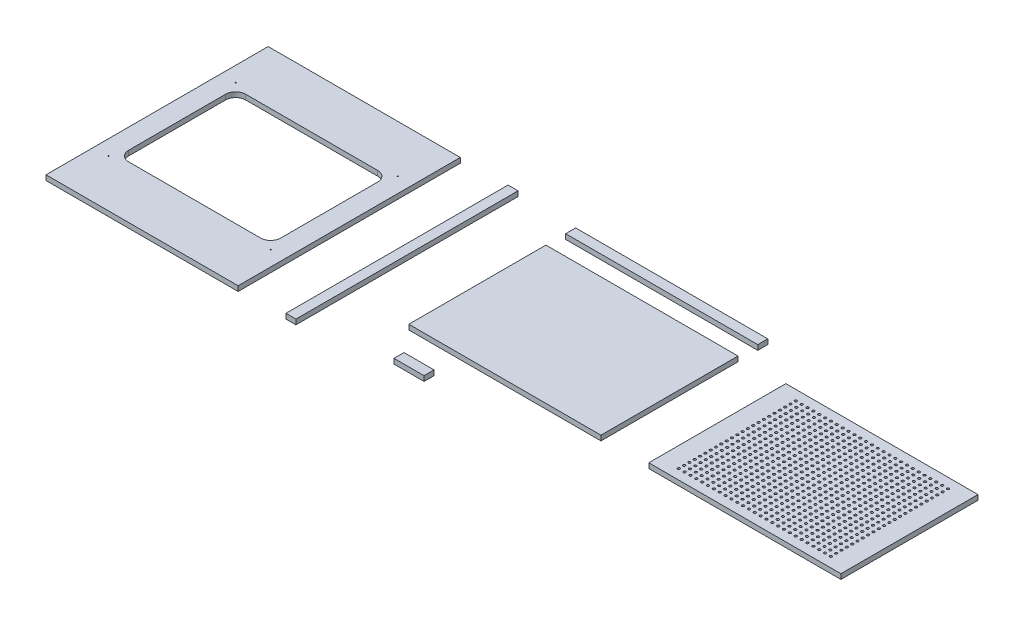
from build123d import *

# Parameters (mm, degrees)
SKETCH1_W             = 384
SKETCH1_H             = 444
SKETCH1_W_2           = 304
SKETCH1_H_2           = 234
SKETCH1_R             = 1
BOSS_EXTRUDE1_DEPTH   = 10
SKETCH1_H_3           = 274
BOSS_EXTRUDE1_2_DEPTH = 10
SKETCH1_W_3           = 20
BOSS_EXTRUDE1_3_DEPTH = 10
SKETCH1_H_4           = 20
BOSS_EXTRUDE1_4_DEPTH = 10
SKETCH1_W_4           = 60
BOSS_EXTRUDE1_5_DEPTH = 10
SKETCH1_R_2           = 2.4
BOSS_EXTRUDE1_6_DEPTH = 10
FILLET1_R             = 20


with BuildPart() as part:
    # Sketch1 → Boss-Extrude1 (new body)
    with BuildSketch(Plane(origin=(0, 0, 0), x_dir=(1, 0, 0), z_dir=(0, 1, 0))):
        Rectangle(SKETCH1_W, SKETCH1_H)
        Rectangle(SKETCH1_W_2, SKETCH1_H_2, mode=Mode.SUBTRACT)
        with Locations((162, 127)):
            Circle(SKETCH1_R, mode=Mode.SUBTRACT)
        with Locations((-162, 127)):
            Circle(SKETCH1_R, mode=Mode.SUBTRACT)
        with Locations((162, -127)):
            Circle(SKETCH1_R, mode=Mode.SUBTRACT)
        with Locations((-162, -127)):
            Circle(SKETCH1_R, mode=Mode.SUBTRACT)
    extrude(amount=BOSS_EXTRUDE1_DEPTH)

    # Fillet1
    fillet1_edges = [part.edges().sort_by_distance(p)[0] for p in [
        (-152, 5, 117),
        (152, 5, 117),
        (152, 5, -117),
        (-152, 5, -117),
    ]]
    fillet(fillet1_edges, radius=FILLET1_R)


with BuildPart() as body_2:
    # Sketch1 → Boss-Extrude1 2 (new body)
    with BuildSketch(Plane(origin=(0, 0, 0), x_dir=(1, 0, 0), z_dir=(0, 1, 0))):
        with Locations((621.209446317, 18.892233675)):
            Rectangle(SKETCH1_W, SKETCH1_H_3)
    extrude(amount=BOSS_EXTRUDE1_2_DEPTH)


with BuildPart() as body_3:
    # Sketch1 → Boss-Extrude1 3 (new body)
    with BuildSketch(Plane(origin=(0, 0, 0), x_dir=(1, 0, 0), z_dir=(0, 1, 0))):
        with Locations((297.479978554, 0)):
            Rectangle(SKETCH1_W_3, SKETCH1_H)
    extrude(amount=BOSS_EXTRUDE1_3_DEPTH)


with BuildPart() as body_4:
    # Sketch1 → Boss-Extrude1 4 (new body)
    with BuildSketch(Plane(origin=(0, 0, 0), x_dir=(1, 0, 0), z_dir=(0, 1, 0))):
        with Locations((621.209446317, 205.35486598)):
            Rectangle(SKETCH1_W, SKETCH1_H_4)
    extrude(amount=BOSS_EXTRUDE1_4_DEPTH)


with BuildPart() as body_5:
    # Sketch1 → Boss-Extrude1 5 (new body)
    with BuildSketch(Plane(origin=(0, 0, 0), x_dir=(1, 0, 0), z_dir=(0, 1, 0))):
        with Locations((503.415257306, -181.953154569)):
            Rectangle(SKETCH1_W_4, SKETCH1_H_4)
    extrude(amount=BOSS_EXTRUDE1_5_DEPTH)


with BuildPart() as body_6:
    # Sketch1 → Boss-Extrude1 6 (new body)
    with BuildSketch(Plane(origin=(0, 0, 0), x_dir=(1, 0, 0), z_dir=(0, 1, 0))):
        with Locations((1100.769882461, 18.892233675)):
            Rectangle(SKETCH1_W, SKETCH1_H_3)
        with Locations((948.769882461, -98.107766325)):
            Circle(SKETCH1_R_2, mode=Mode.SUBTRACT)
        with Locations((960.462190153, -98.107766325)):
            Circle(SKETCH1_R_2, mode=Mode.SUBTRACT)
        with Locations((972.154497845, -98.107766325)):
            Circle(SKETCH1_R_2, mode=Mode.SUBTRACT)
        with Locations((983.846805538, -98.107766325)):
            Circle(SKETCH1_R_2, mode=Mode.SUBTRACT)
        with Locations((995.53911323, -98.107766325)):
            Circle(SKETCH1_R_2, mode=Mode.SUBTRACT)
        with Locations((1007.231420922, -98.107766325)):
            Circle(SKETCH1_R_2, mode=Mode.SUBTRACT)
        with Locations((948.769882461, -87.471402688)):
            Circle(SKETCH1_R_2, mode=Mode.SUBTRACT)
        with Locations((960.462190153, -87.471402688)):
            Circle(SKETCH1_R_2, mode=Mode.SUBTRACT)
        with Locations((972.154497845, -87.471402688)):
            Circle(SKETCH1_R_2, mode=Mode.SUBTRACT)
        with Locations((983.846805538, -87.471402688)):
            Circle(SKETCH1_R_2, mode=Mode.SUBTRACT)
        with Locations((995.53911323, -87.471402688)):
            Circle(SKETCH1_R_2, mode=Mode.SUBTRACT)
        with Locations((1007.231420922, -87.471402688)):
            Circle(SKETCH1_R_2, mode=Mode.SUBTRACT)
        with Locations((1018.923728614, -98.107766325)):
            Circle(SKETCH1_R_2, mode=Mode.SUBTRACT)
        with Locations((1030.616036307, -98.107766325)):
            Circle(SKETCH1_R_2, mode=Mode.SUBTRACT)
        with Locations((1042.308343999, -98.107766325)):
            Circle(SKETCH1_R_2, mode=Mode.SUBTRACT)
        with Locations((1054.000651691, -98.107766325)):
            Circle(SKETCH1_R_2, mode=Mode.SUBTRACT)
        with Locations((1065.692959384, -98.107766325)):
            Circle(SKETCH1_R_2, mode=Mode.SUBTRACT)
        with Locations((1077.385267076, -98.107766325)):
            Circle(SKETCH1_R_2, mode=Mode.SUBTRACT)
        with Locations((1089.077574768, -98.107766325)):
            Circle(SKETCH1_R_2, mode=Mode.SUBTRACT)
        with Locations((1100.769882461, -98.107766325)):
            Circle(SKETCH1_R_2, mode=Mode.SUBTRACT)
        with Locations((1018.923728614, -87.471402688)):
            Circle(SKETCH1_R_2, mode=Mode.SUBTRACT)
        with Locations((1030.616036307, -87.471402688)):
            Circle(SKETCH1_R_2, mode=Mode.SUBTRACT)
        with Locations((1042.308343999, -87.471402688)):
            Circle(SKETCH1_R_2, mode=Mode.SUBTRACT)
        with Locations((1054.000651691, -87.471402688)):
            Circle(SKETCH1_R_2, mode=Mode.SUBTRACT)
        with Locations((1065.692959384, -87.471402688)):
            Circle(SKETCH1_R_2, mode=Mode.SUBTRACT)
        with Locations((1077.385267076, -87.471402688)):
            Circle(SKETCH1_R_2, mode=Mode.SUBTRACT)
        with Locations((1089.077574768, -87.471402688)):
            Circle(SKETCH1_R_2, mode=Mode.SUBTRACT)
        with Locations((1100.769882461, -87.471402688)):
            Circle(SKETCH1_R_2, mode=Mode.SUBTRACT)
        with Locations((948.769882461, -76.835039052)):
            Circle(SKETCH1_R_2, mode=Mode.SUBTRACT)
        with Locations((960.462190153, -76.835039052)):
            Circle(SKETCH1_R_2, mode=Mode.SUBTRACT)
        with Locations((972.154497845, -76.835039052)):
            Circle(SKETCH1_R_2, mode=Mode.SUBTRACT)
        with Locations((983.846805538, -76.835039052)):
            Circle(SKETCH1_R_2, mode=Mode.SUBTRACT)
        with Locations((995.53911323, -76.835039052)):
            Circle(SKETCH1_R_2, mode=Mode.SUBTRACT)
        with Locations((1007.231420922, -76.835039052)):
            Circle(SKETCH1_R_2, mode=Mode.SUBTRACT)
        with Locations((948.769882461, -66.198675415)):
            Circle(SKETCH1_R_2, mode=Mode.SUBTRACT)
        with Locations((960.462190153, -66.198675415)):
            Circle(SKETCH1_R_2, mode=Mode.SUBTRACT)
        with Locations((948.769882461, -55.562311779)):
            Circle(SKETCH1_R_2, mode=Mode.SUBTRACT)
        with Locations((960.462190153, -55.562311779)):
            Circle(SKETCH1_R_2, mode=Mode.SUBTRACT)
        with Locations((972.154497845, -66.198675415)):
            Circle(SKETCH1_R_2, mode=Mode.SUBTRACT)
        with Locations((983.846805538, -66.198675415)):
            Circle(SKETCH1_R_2, mode=Mode.SUBTRACT)
        with Locations((995.53911323, -66.198675415)):
            Circle(SKETCH1_R_2, mode=Mode.SUBTRACT)
        with Locations((1007.231420922, -66.198675415)):
            Circle(SKETCH1_R_2, mode=Mode.SUBTRACT)
        with Locations((972.154497845, -55.562311779)):
            Circle(SKETCH1_R_2, mode=Mode.SUBTRACT)
        with Locations((983.846805538, -55.562311779)):
            Circle(SKETCH1_R_2, mode=Mode.SUBTRACT)
        with Locations((995.53911323, -55.562311779)):
            Circle(SKETCH1_R_2, mode=Mode.SUBTRACT)
        with Locations((1007.231420922, -55.562311779)):
            Circle(SKETCH1_R_2, mode=Mode.SUBTRACT)
        with Locations((1018.923728614, -76.835039052)):
            Circle(SKETCH1_R_2, mode=Mode.SUBTRACT)
        with Locations((1030.616036307, -76.835039052)):
            Circle(SKETCH1_R_2, mode=Mode.SUBTRACT)
        with Locations((1042.308343999, -76.835039052)):
            Circle(SKETCH1_R_2, mode=Mode.SUBTRACT)
        with Locations((1054.000651691, -76.835039052)):
            Circle(SKETCH1_R_2, mode=Mode.SUBTRACT)
        with Locations((1065.692959384, -76.835039052)):
            Circle(SKETCH1_R_2, mode=Mode.SUBTRACT)
        with Locations((1077.385267076, -76.835039052)):
            Circle(SKETCH1_R_2, mode=Mode.SUBTRACT)
        with Locations((1089.077574768, -76.835039052)):
            Circle(SKETCH1_R_2, mode=Mode.SUBTRACT)
        with Locations((1100.769882461, -76.835039052)):
            Circle(SKETCH1_R_2, mode=Mode.SUBTRACT)
        with Locations((1018.923728614, -66.198675415)):
            Circle(SKETCH1_R_2, mode=Mode.SUBTRACT)
        with Locations((1030.616036307, -66.198675415)):
            Circle(SKETCH1_R_2, mode=Mode.SUBTRACT)
        with Locations((1042.308343999, -66.198675415)):
            Circle(SKETCH1_R_2, mode=Mode.SUBTRACT)
        with Locations((1054.000651691, -66.198675415)):
            Circle(SKETCH1_R_2, mode=Mode.SUBTRACT)
        with Locations((1018.923728614, -55.562311779)):
            Circle(SKETCH1_R_2, mode=Mode.SUBTRACT)
        with Locations((1030.616036307, -55.562311779)):
            Circle(SKETCH1_R_2, mode=Mode.SUBTRACT)
        with Locations((1042.308343999, -55.562311779)):
            Circle(SKETCH1_R_2, mode=Mode.SUBTRACT)
        with Locations((1054.000651691, -55.562311779)):
            Circle(SKETCH1_R_2, mode=Mode.SUBTRACT)
        with Locations((1065.692959384, -66.198675415)):
            Circle(SKETCH1_R_2, mode=Mode.SUBTRACT)
        with Locations((1077.385267076, -66.198675415)):
            Circle(SKETCH1_R_2, mode=Mode.SUBTRACT)
        with Locations((1089.077574768, -66.198675415)):
            Circle(SKETCH1_R_2, mode=Mode.SUBTRACT)
        with Locations((1100.769882461, -66.198675415)):
            Circle(SKETCH1_R_2, mode=Mode.SUBTRACT)
        with Locations((1065.692959384, -55.562311779)):
            Circle(SKETCH1_R_2, mode=Mode.SUBTRACT)
        with Locations((1077.385267076, -55.562311779)):
            Circle(SKETCH1_R_2, mode=Mode.SUBTRACT)
        with Locations((1089.077574768, -55.562311779)):
            Circle(SKETCH1_R_2, mode=Mode.SUBTRACT)
        with Locations((1100.769882461, -55.562311779)):
            Circle(SKETCH1_R_2, mode=Mode.SUBTRACT)
        with Locations((1112.462190153, -98.107766325)):
            Circle(SKETCH1_R_2, mode=Mode.SUBTRACT)
        with Locations((1124.154497845, -98.107766325)):
            Circle(SKETCH1_R_2, mode=Mode.SUBTRACT)
        with Locations((1135.846805538, -98.107766325)):
            Circle(SKETCH1_R_2, mode=Mode.SUBTRACT)
        with Locations((1147.53911323, -98.107766325)):
            Circle(SKETCH1_R_2, mode=Mode.SUBTRACT)
        with Locations((1159.231420922, -98.107766325)):
            Circle(SKETCH1_R_2, mode=Mode.SUBTRACT)
        with Locations((1170.923728614, -98.107766325)):
            Circle(SKETCH1_R_2, mode=Mode.SUBTRACT)
        with Locations((1182.616036307, -98.107766325)):
            Circle(SKETCH1_R_2, mode=Mode.SUBTRACT)
        with Locations((1194.308343999, -98.107766325)):
            Circle(SKETCH1_R_2, mode=Mode.SUBTRACT)
        with Locations((1112.462190153, -87.471402688)):
            Circle(SKETCH1_R_2, mode=Mode.SUBTRACT)
        with Locations((1124.154497845, -87.471402688)):
            Circle(SKETCH1_R_2, mode=Mode.SUBTRACT)
        with Locations((1135.846805538, -87.471402688)):
            Circle(SKETCH1_R_2, mode=Mode.SUBTRACT)
        with Locations((1147.53911323, -87.471402688)):
            Circle(SKETCH1_R_2, mode=Mode.SUBTRACT)
        with Locations((1159.231420922, -87.471402688)):
            Circle(SKETCH1_R_2, mode=Mode.SUBTRACT)
        with Locations((1170.923728614, -87.471402688)):
            Circle(SKETCH1_R_2, mode=Mode.SUBTRACT)
        with Locations((1182.616036307, -87.471402688)):
            Circle(SKETCH1_R_2, mode=Mode.SUBTRACT)
        with Locations((1194.308343999, -87.471402688)):
            Circle(SKETCH1_R_2, mode=Mode.SUBTRACT)
        with Locations((1206.000651691, -98.107766325)):
            Circle(SKETCH1_R_2, mode=Mode.SUBTRACT)
        with Locations((1217.692959384, -98.107766325)):
            Circle(SKETCH1_R_2, mode=Mode.SUBTRACT)
        with Locations((1229.385267076, -98.107766325)):
            Circle(SKETCH1_R_2, mode=Mode.SUBTRACT)
        with Locations((1241.077574768, -98.107766325)):
            Circle(SKETCH1_R_2, mode=Mode.SUBTRACT)
        with Locations((1252.769882461, -98.107766325)):
            Circle(SKETCH1_R_2, mode=Mode.SUBTRACT)
        with Locations((1206.000651691, -87.471402688)):
            Circle(SKETCH1_R_2, mode=Mode.SUBTRACT)
        with Locations((1217.692959384, -87.471402688)):
            Circle(SKETCH1_R_2, mode=Mode.SUBTRACT)
        with Locations((1229.385267076, -87.471402688)):
            Circle(SKETCH1_R_2, mode=Mode.SUBTRACT)
        with Locations((1241.077574768, -87.471402688)):
            Circle(SKETCH1_R_2, mode=Mode.SUBTRACT)
        with Locations((1252.769882461, -87.471402688)):
            Circle(SKETCH1_R_2, mode=Mode.SUBTRACT)
        with Locations((1112.462190153, -76.835039052)):
            Circle(SKETCH1_R_2, mode=Mode.SUBTRACT)
        with Locations((1124.154497845, -76.835039052)):
            Circle(SKETCH1_R_2, mode=Mode.SUBTRACT)
        with Locations((1135.846805538, -76.835039052)):
            Circle(SKETCH1_R_2, mode=Mode.SUBTRACT)
        with Locations((1147.53911323, -76.835039052)):
            Circle(SKETCH1_R_2, mode=Mode.SUBTRACT)
        with Locations((1159.231420922, -76.835039052)):
            Circle(SKETCH1_R_2, mode=Mode.SUBTRACT)
        with Locations((1170.923728614, -76.835039052)):
            Circle(SKETCH1_R_2, mode=Mode.SUBTRACT)
        with Locations((1182.616036307, -76.835039052)):
            Circle(SKETCH1_R_2, mode=Mode.SUBTRACT)
        with Locations((1194.308343999, -76.835039052)):
            Circle(SKETCH1_R_2, mode=Mode.SUBTRACT)
        with Locations((1112.462190153, -66.198675415)):
            Circle(SKETCH1_R_2, mode=Mode.SUBTRACT)
        with Locations((1124.154497845, -66.198675415)):
            Circle(SKETCH1_R_2, mode=Mode.SUBTRACT)
        with Locations((1135.846805538, -66.198675415)):
            Circle(SKETCH1_R_2, mode=Mode.SUBTRACT)
        with Locations((1147.53911323, -66.198675415)):
            Circle(SKETCH1_R_2, mode=Mode.SUBTRACT)
        with Locations((1112.462190153, -55.562311779)):
            Circle(SKETCH1_R_2, mode=Mode.SUBTRACT)
        with Locations((1124.154497845, -55.562311779)):
            Circle(SKETCH1_R_2, mode=Mode.SUBTRACT)
        with Locations((1135.846805538, -55.562311779)):
            Circle(SKETCH1_R_2, mode=Mode.SUBTRACT)
        with Locations((1147.53911323, -55.562311779)):
            Circle(SKETCH1_R_2, mode=Mode.SUBTRACT)
        with Locations((1159.231420922, -66.198675415)):
            Circle(SKETCH1_R_2, mode=Mode.SUBTRACT)
        with Locations((1170.923728614, -66.198675415)):
            Circle(SKETCH1_R_2, mode=Mode.SUBTRACT)
        with Locations((1182.616036307, -66.198675415)):
            Circle(SKETCH1_R_2, mode=Mode.SUBTRACT)
        with Locations((1194.308343999, -66.198675415)):
            Circle(SKETCH1_R_2, mode=Mode.SUBTRACT)
        with Locations((1159.231420922, -55.562311779)):
            Circle(SKETCH1_R_2, mode=Mode.SUBTRACT)
        with Locations((1170.923728614, -55.562311779)):
            Circle(SKETCH1_R_2, mode=Mode.SUBTRACT)
        with Locations((1182.616036307, -55.562311779)):
            Circle(SKETCH1_R_2, mode=Mode.SUBTRACT)
        with Locations((1194.308343999, -55.562311779)):
            Circle(SKETCH1_R_2, mode=Mode.SUBTRACT)
        with Locations((1206.000651691, -76.835039052)):
            Circle(SKETCH1_R_2, mode=Mode.SUBTRACT)
        with Locations((1217.692959384, -76.835039052)):
            Circle(SKETCH1_R_2, mode=Mode.SUBTRACT)
        with Locations((1229.385267076, -76.835039052)):
            Circle(SKETCH1_R_2, mode=Mode.SUBTRACT)
        with Locations((1241.077574768, -76.835039052)):
            Circle(SKETCH1_R_2, mode=Mode.SUBTRACT)
        with Locations((1252.769882461, -76.835039052)):
            Circle(SKETCH1_R_2, mode=Mode.SUBTRACT)
        with Locations((1206.000651691, -66.198675415)):
            Circle(SKETCH1_R_2, mode=Mode.SUBTRACT)
        with Locations((1217.692959384, -66.198675415)):
            Circle(SKETCH1_R_2, mode=Mode.SUBTRACT)
        with Locations((1229.385267076, -66.198675415)):
            Circle(SKETCH1_R_2, mode=Mode.SUBTRACT)
        with Locations((1241.077574768, -66.198675415)):
            Circle(SKETCH1_R_2, mode=Mode.SUBTRACT)
        with Locations((1206.000651691, -55.562311779)):
            Circle(SKETCH1_R_2, mode=Mode.SUBTRACT)
        with Locations((1217.692959384, -55.562311779)):
            Circle(SKETCH1_R_2, mode=Mode.SUBTRACT)
        with Locations((1229.385267076, -55.562311779)):
            Circle(SKETCH1_R_2, mode=Mode.SUBTRACT)
        with Locations((1241.077574768, -55.562311779)):
            Circle(SKETCH1_R_2, mode=Mode.SUBTRACT)
        with Locations((1252.769882461, -66.198675415)):
            Circle(SKETCH1_R_2, mode=Mode.SUBTRACT)
        with Locations((1252.769882461, -55.562311779)):
            Circle(SKETCH1_R_2, mode=Mode.SUBTRACT)
        with Locations((948.769882461, -44.925948143)):
            Circle(SKETCH1_R_2, mode=Mode.SUBTRACT)
        with Locations((960.462190153, -44.925948143)):
            Circle(SKETCH1_R_2, mode=Mode.SUBTRACT)
        with Locations((972.154497845, -44.925948143)):
            Circle(SKETCH1_R_2, mode=Mode.SUBTRACT)
        with Locations((983.846805538, -44.925948143)):
            Circle(SKETCH1_R_2, mode=Mode.SUBTRACT)
        with Locations((995.53911323, -44.925948143)):
            Circle(SKETCH1_R_2, mode=Mode.SUBTRACT)
        with Locations((1007.231420922, -44.925948143)):
            Circle(SKETCH1_R_2, mode=Mode.SUBTRACT)
        with Locations((948.769882461, -34.289584506)):
            Circle(SKETCH1_R_2, mode=Mode.SUBTRACT)
        with Locations((960.462190153, -34.289584506)):
            Circle(SKETCH1_R_2, mode=Mode.SUBTRACT)
        with Locations((972.154497845, -34.289584506)):
            Circle(SKETCH1_R_2, mode=Mode.SUBTRACT)
        with Locations((983.846805538, -34.289584506)):
            Circle(SKETCH1_R_2, mode=Mode.SUBTRACT)
        with Locations((995.53911323, -34.289584506)):
            Circle(SKETCH1_R_2, mode=Mode.SUBTRACT)
        with Locations((1007.231420922, -34.289584506)):
            Circle(SKETCH1_R_2, mode=Mode.SUBTRACT)
        with Locations((1018.923728614, -44.925948143)):
            Circle(SKETCH1_R_2, mode=Mode.SUBTRACT)
        with Locations((1030.616036307, -44.925948143)):
            Circle(SKETCH1_R_2, mode=Mode.SUBTRACT)
        with Locations((1042.308343999, -44.925948143)):
            Circle(SKETCH1_R_2, mode=Mode.SUBTRACT)
        with Locations((1054.000651691, -44.925948143)):
            Circle(SKETCH1_R_2, mode=Mode.SUBTRACT)
        with Locations((1065.692959384, -44.925948143)):
            Circle(SKETCH1_R_2, mode=Mode.SUBTRACT)
        with Locations((1077.385267076, -44.925948143)):
            Circle(SKETCH1_R_2, mode=Mode.SUBTRACT)
        with Locations((1089.077574768, -44.925948143)):
            Circle(SKETCH1_R_2, mode=Mode.SUBTRACT)
        with Locations((1100.769882461, -44.925948143)):
            Circle(SKETCH1_R_2, mode=Mode.SUBTRACT)
        with Locations((1018.923728614, -34.289584506)):
            Circle(SKETCH1_R_2, mode=Mode.SUBTRACT)
        with Locations((1030.616036307, -34.289584506)):
            Circle(SKETCH1_R_2, mode=Mode.SUBTRACT)
        with Locations((1042.308343999, -34.289584506)):
            Circle(SKETCH1_R_2, mode=Mode.SUBTRACT)
        with Locations((1054.000651691, -34.289584506)):
            Circle(SKETCH1_R_2, mode=Mode.SUBTRACT)
        with Locations((1065.692959384, -34.289584506)):
            Circle(SKETCH1_R_2, mode=Mode.SUBTRACT)
        with Locations((1077.385267076, -34.289584506)):
            Circle(SKETCH1_R_2, mode=Mode.SUBTRACT)
        with Locations((1089.077574768, -34.289584506)):
            Circle(SKETCH1_R_2, mode=Mode.SUBTRACT)
        with Locations((1100.769882461, -34.289584506)):
            Circle(SKETCH1_R_2, mode=Mode.SUBTRACT)
        with Locations((948.769882461, -23.65322087)):
            Circle(SKETCH1_R_2, mode=Mode.SUBTRACT)
        with Locations((960.462190153, -23.65322087)):
            Circle(SKETCH1_R_2, mode=Mode.SUBTRACT)
        with Locations((972.154497845, -23.65322087)):
            Circle(SKETCH1_R_2, mode=Mode.SUBTRACT)
        with Locations((983.846805538, -23.65322087)):
            Circle(SKETCH1_R_2, mode=Mode.SUBTRACT)
        with Locations((995.53911323, -23.65322087)):
            Circle(SKETCH1_R_2, mode=Mode.SUBTRACT)
        with Locations((1007.231420922, -23.65322087)):
            Circle(SKETCH1_R_2, mode=Mode.SUBTRACT)
        with Locations((948.769882461, -13.016857234)):
            Circle(SKETCH1_R_2, mode=Mode.SUBTRACT)
        with Locations((960.462190153, -13.016857234)):
            Circle(SKETCH1_R_2, mode=Mode.SUBTRACT)
        with Locations((948.769882461, -2.380493597)):
            Circle(SKETCH1_R_2, mode=Mode.SUBTRACT)
        with Locations((960.462190153, -2.380493597)):
            Circle(SKETCH1_R_2, mode=Mode.SUBTRACT)
        with Locations((972.154497845, -13.016857234)):
            Circle(SKETCH1_R_2, mode=Mode.SUBTRACT)
        with Locations((983.846805538, -13.016857234)):
            Circle(SKETCH1_R_2, mode=Mode.SUBTRACT)
        with Locations((995.53911323, -13.016857234)):
            Circle(SKETCH1_R_2, mode=Mode.SUBTRACT)
        with Locations((1007.231420922, -13.016857234)):
            Circle(SKETCH1_R_2, mode=Mode.SUBTRACT)
        with Locations((972.154497845, -2.380493597)):
            Circle(SKETCH1_R_2, mode=Mode.SUBTRACT)
        with Locations((983.846805538, -2.380493597)):
            Circle(SKETCH1_R_2, mode=Mode.SUBTRACT)
        with Locations((995.53911323, -2.380493597)):
            Circle(SKETCH1_R_2, mode=Mode.SUBTRACT)
        with Locations((1007.231420922, -2.380493597)):
            Circle(SKETCH1_R_2, mode=Mode.SUBTRACT)
        with Locations((1018.923728614, -23.65322087)):
            Circle(SKETCH1_R_2, mode=Mode.SUBTRACT)
        with Locations((1030.616036307, -23.65322087)):
            Circle(SKETCH1_R_2, mode=Mode.SUBTRACT)
        with Locations((1042.308343999, -23.65322087)):
            Circle(SKETCH1_R_2, mode=Mode.SUBTRACT)
        with Locations((1054.000651691, -23.65322087)):
            Circle(SKETCH1_R_2, mode=Mode.SUBTRACT)
        with Locations((1065.692959384, -23.65322087)):
            Circle(SKETCH1_R_2, mode=Mode.SUBTRACT)
        with Locations((1077.385267076, -23.65322087)):
            Circle(SKETCH1_R_2, mode=Mode.SUBTRACT)
        with Locations((1089.077574768, -23.65322087)):
            Circle(SKETCH1_R_2, mode=Mode.SUBTRACT)
        with Locations((1100.769882461, -23.65322087)):
            Circle(SKETCH1_R_2, mode=Mode.SUBTRACT)
        with Locations((1018.923728614, -13.016857234)):
            Circle(SKETCH1_R_2, mode=Mode.SUBTRACT)
        with Locations((1030.616036307, -13.016857234)):
            Circle(SKETCH1_R_2, mode=Mode.SUBTRACT)
        with Locations((1042.308343999, -13.016857234)):
            Circle(SKETCH1_R_2, mode=Mode.SUBTRACT)
        with Locations((1054.000651691, -13.016857234)):
            Circle(SKETCH1_R_2, mode=Mode.SUBTRACT)
        with Locations((1018.923728614, -2.380493597)):
            Circle(SKETCH1_R_2, mode=Mode.SUBTRACT)
        with Locations((1030.616036307, -2.380493597)):
            Circle(SKETCH1_R_2, mode=Mode.SUBTRACT)
        with Locations((1042.308343999, -2.380493597)):
            Circle(SKETCH1_R_2, mode=Mode.SUBTRACT)
        with Locations((1054.000651691, -2.380493597)):
            Circle(SKETCH1_R_2, mode=Mode.SUBTRACT)
        with Locations((1065.692959384, -13.016857234)):
            Circle(SKETCH1_R_2, mode=Mode.SUBTRACT)
        with Locations((1077.385267076, -13.016857234)):
            Circle(SKETCH1_R_2, mode=Mode.SUBTRACT)
        with Locations((1089.077574768, -13.016857234)):
            Circle(SKETCH1_R_2, mode=Mode.SUBTRACT)
        with Locations((1100.769882461, -13.016857234)):
            Circle(SKETCH1_R_2, mode=Mode.SUBTRACT)
        with Locations((1065.692959384, -2.380493597)):
            Circle(SKETCH1_R_2, mode=Mode.SUBTRACT)
        with Locations((1077.385267076, -2.380493597)):
            Circle(SKETCH1_R_2, mode=Mode.SUBTRACT)
        with Locations((1089.077574768, -2.380493597)):
            Circle(SKETCH1_R_2, mode=Mode.SUBTRACT)
        with Locations((1100.769882461, -2.380493597)):
            Circle(SKETCH1_R_2, mode=Mode.SUBTRACT)
        with Locations((1112.462190153, -44.925948143)):
            Circle(SKETCH1_R_2, mode=Mode.SUBTRACT)
        with Locations((1124.154497845, -44.925948143)):
            Circle(SKETCH1_R_2, mode=Mode.SUBTRACT)
        with Locations((1135.846805538, -44.925948143)):
            Circle(SKETCH1_R_2, mode=Mode.SUBTRACT)
        with Locations((1147.53911323, -44.925948143)):
            Circle(SKETCH1_R_2, mode=Mode.SUBTRACT)
        with Locations((1159.231420922, -44.925948143)):
            Circle(SKETCH1_R_2, mode=Mode.SUBTRACT)
        with Locations((1170.923728614, -44.925948143)):
            Circle(SKETCH1_R_2, mode=Mode.SUBTRACT)
        with Locations((1182.616036307, -44.925948143)):
            Circle(SKETCH1_R_2, mode=Mode.SUBTRACT)
        with Locations((1194.308343999, -44.925948143)):
            Circle(SKETCH1_R_2, mode=Mode.SUBTRACT)
        with Locations((1112.462190153, -34.289584506)):
            Circle(SKETCH1_R_2, mode=Mode.SUBTRACT)
        with Locations((1124.154497845, -34.289584506)):
            Circle(SKETCH1_R_2, mode=Mode.SUBTRACT)
        with Locations((1135.846805538, -34.289584506)):
            Circle(SKETCH1_R_2, mode=Mode.SUBTRACT)
        with Locations((1147.53911323, -34.289584506)):
            Circle(SKETCH1_R_2, mode=Mode.SUBTRACT)
        with Locations((1159.231420922, -34.289584506)):
            Circle(SKETCH1_R_2, mode=Mode.SUBTRACT)
        with Locations((1170.923728614, -34.289584506)):
            Circle(SKETCH1_R_2, mode=Mode.SUBTRACT)
        with Locations((1182.616036307, -34.289584506)):
            Circle(SKETCH1_R_2, mode=Mode.SUBTRACT)
        with Locations((1194.308343999, -34.289584506)):
            Circle(SKETCH1_R_2, mode=Mode.SUBTRACT)
        with Locations((1206.000651691, -44.925948143)):
            Circle(SKETCH1_R_2, mode=Mode.SUBTRACT)
        with Locations((1217.692959384, -44.925948143)):
            Circle(SKETCH1_R_2, mode=Mode.SUBTRACT)
        with Locations((1229.385267076, -44.925948143)):
            Circle(SKETCH1_R_2, mode=Mode.SUBTRACT)
        with Locations((1241.077574768, -44.925948143)):
            Circle(SKETCH1_R_2, mode=Mode.SUBTRACT)
        with Locations((1252.769882461, -44.925948143)):
            Circle(SKETCH1_R_2, mode=Mode.SUBTRACT)
        with Locations((1206.000651691, -34.289584506)):
            Circle(SKETCH1_R_2, mode=Mode.SUBTRACT)
        with Locations((1217.692959384, -34.289584506)):
            Circle(SKETCH1_R_2, mode=Mode.SUBTRACT)
        with Locations((1229.385267076, -34.289584506)):
            Circle(SKETCH1_R_2, mode=Mode.SUBTRACT)
        with Locations((1241.077574768, -34.289584506)):
            Circle(SKETCH1_R_2, mode=Mode.SUBTRACT)
        with Locations((1252.769882461, -34.289584506)):
            Circle(SKETCH1_R_2, mode=Mode.SUBTRACT)
        with Locations((1112.462190153, -23.65322087)):
            Circle(SKETCH1_R_2, mode=Mode.SUBTRACT)
        with Locations((1124.154497845, -23.65322087)):
            Circle(SKETCH1_R_2, mode=Mode.SUBTRACT)
        with Locations((1135.846805538, -23.65322087)):
            Circle(SKETCH1_R_2, mode=Mode.SUBTRACT)
        with Locations((1147.53911323, -23.65322087)):
            Circle(SKETCH1_R_2, mode=Mode.SUBTRACT)
        with Locations((1159.231420922, -23.65322087)):
            Circle(SKETCH1_R_2, mode=Mode.SUBTRACT)
        with Locations((1170.923728614, -23.65322087)):
            Circle(SKETCH1_R_2, mode=Mode.SUBTRACT)
        with Locations((1182.616036307, -23.65322087)):
            Circle(SKETCH1_R_2, mode=Mode.SUBTRACT)
        with Locations((1194.308343999, -23.65322087)):
            Circle(SKETCH1_R_2, mode=Mode.SUBTRACT)
        with Locations((1112.462190153, -13.016857234)):
            Circle(SKETCH1_R_2, mode=Mode.SUBTRACT)
        with Locations((1124.154497845, -13.016857234)):
            Circle(SKETCH1_R_2, mode=Mode.SUBTRACT)
        with Locations((1135.846805538, -13.016857234)):
            Circle(SKETCH1_R_2, mode=Mode.SUBTRACT)
        with Locations((1147.53911323, -13.016857234)):
            Circle(SKETCH1_R_2, mode=Mode.SUBTRACT)
        with Locations((1112.462190153, -2.380493597)):
            Circle(SKETCH1_R_2, mode=Mode.SUBTRACT)
        with Locations((1124.154497845, -2.380493597)):
            Circle(SKETCH1_R_2, mode=Mode.SUBTRACT)
        with Locations((1135.846805538, -2.380493597)):
            Circle(SKETCH1_R_2, mode=Mode.SUBTRACT)
        with Locations((1147.53911323, -2.380493597)):
            Circle(SKETCH1_R_2, mode=Mode.SUBTRACT)
        with Locations((1159.231420922, -13.016857234)):
            Circle(SKETCH1_R_2, mode=Mode.SUBTRACT)
        with Locations((1170.923728614, -13.016857234)):
            Circle(SKETCH1_R_2, mode=Mode.SUBTRACT)
        with Locations((1182.616036307, -13.016857234)):
            Circle(SKETCH1_R_2, mode=Mode.SUBTRACT)
        with Locations((1194.308343999, -13.016857234)):
            Circle(SKETCH1_R_2, mode=Mode.SUBTRACT)
        with Locations((1159.231420922, -2.380493597)):
            Circle(SKETCH1_R_2, mode=Mode.SUBTRACT)
        with Locations((1170.923728614, -2.380493597)):
            Circle(SKETCH1_R_2, mode=Mode.SUBTRACT)
        with Locations((1182.616036307, -2.380493597)):
            Circle(SKETCH1_R_2, mode=Mode.SUBTRACT)
        with Locations((1194.308343999, -2.380493597)):
            Circle(SKETCH1_R_2, mode=Mode.SUBTRACT)
        with Locations((1206.000651691, -23.65322087)):
            Circle(SKETCH1_R_2, mode=Mode.SUBTRACT)
        with Locations((1217.692959384, -23.65322087)):
            Circle(SKETCH1_R_2, mode=Mode.SUBTRACT)
        with Locations((1229.385267076, -23.65322087)):
            Circle(SKETCH1_R_2, mode=Mode.SUBTRACT)
        with Locations((1241.077574768, -23.65322087)):
            Circle(SKETCH1_R_2, mode=Mode.SUBTRACT)
        with Locations((1252.769882461, -23.65322087)):
            Circle(SKETCH1_R_2, mode=Mode.SUBTRACT)
        with Locations((1206.000651691, -13.016857234)):
            Circle(SKETCH1_R_2, mode=Mode.SUBTRACT)
        with Locations((1217.692959384, -13.016857234)):
            Circle(SKETCH1_R_2, mode=Mode.SUBTRACT)
        with Locations((1229.385267076, -13.016857234)):
            Circle(SKETCH1_R_2, mode=Mode.SUBTRACT)
        with Locations((1241.077574768, -13.016857234)):
            Circle(SKETCH1_R_2, mode=Mode.SUBTRACT)
        with Locations((1206.000651691, -2.380493597)):
            Circle(SKETCH1_R_2, mode=Mode.SUBTRACT)
        with Locations((1217.692959384, -2.380493597)):
            Circle(SKETCH1_R_2, mode=Mode.SUBTRACT)
        with Locations((1229.385267076, -2.380493597)):
            Circle(SKETCH1_R_2, mode=Mode.SUBTRACT)
        with Locations((1241.077574768, -2.380493597)):
            Circle(SKETCH1_R_2, mode=Mode.SUBTRACT)
        with Locations((1252.769882461, -13.016857234)):
            Circle(SKETCH1_R_2, mode=Mode.SUBTRACT)
        with Locations((1252.769882461, -2.380493597)):
            Circle(SKETCH1_R_2, mode=Mode.SUBTRACT)
        with Locations((948.769882461, 8.255870039)):
            Circle(SKETCH1_R_2, mode=Mode.SUBTRACT)
        with Locations((960.462190153, 8.255870039)):
            Circle(SKETCH1_R_2, mode=Mode.SUBTRACT)
        with Locations((972.154497845, 8.255870039)):
            Circle(SKETCH1_R_2, mode=Mode.SUBTRACT)
        with Locations((983.846805538, 8.255870039)):
            Circle(SKETCH1_R_2, mode=Mode.SUBTRACT)
        with Locations((995.53911323, 8.255870039)):
            Circle(SKETCH1_R_2, mode=Mode.SUBTRACT)
        with Locations((1007.231420922, 8.255870039)):
            Circle(SKETCH1_R_2, mode=Mode.SUBTRACT)
        with Locations((948.769882461, 18.892233675)):
            Circle(SKETCH1_R_2, mode=Mode.SUBTRACT)
        with Locations((960.462190153, 18.892233675)):
            Circle(SKETCH1_R_2, mode=Mode.SUBTRACT)
        with Locations((972.154497845, 18.892233675)):
            Circle(SKETCH1_R_2, mode=Mode.SUBTRACT)
        with Locations((983.846805538, 18.892233675)):
            Circle(SKETCH1_R_2, mode=Mode.SUBTRACT)
        with Locations((995.53911323, 18.892233675)):
            Circle(SKETCH1_R_2, mode=Mode.SUBTRACT)
        with Locations((1007.231420922, 18.892233675)):
            Circle(SKETCH1_R_2, mode=Mode.SUBTRACT)
        with Locations((1018.923728614, 8.255870039)):
            Circle(SKETCH1_R_2, mode=Mode.SUBTRACT)
        with Locations((1030.616036307, 8.255870039)):
            Circle(SKETCH1_R_2, mode=Mode.SUBTRACT)
        with Locations((1042.308343999, 8.255870039)):
            Circle(SKETCH1_R_2, mode=Mode.SUBTRACT)
        with Locations((1054.000651691, 8.255870039)):
            Circle(SKETCH1_R_2, mode=Mode.SUBTRACT)
        with Locations((1065.692959384, 8.255870039)):
            Circle(SKETCH1_R_2, mode=Mode.SUBTRACT)
        with Locations((1077.385267076, 8.255870039)):
            Circle(SKETCH1_R_2, mode=Mode.SUBTRACT)
        with Locations((1089.077574768, 8.255870039)):
            Circle(SKETCH1_R_2, mode=Mode.SUBTRACT)
        with Locations((1100.769882461, 8.255870039)):
            Circle(SKETCH1_R_2, mode=Mode.SUBTRACT)
        with Locations((1018.923728614, 18.892233675)):
            Circle(SKETCH1_R_2, mode=Mode.SUBTRACT)
        with Locations((1030.616036307, 18.892233675)):
            Circle(SKETCH1_R_2, mode=Mode.SUBTRACT)
        with Locations((1042.308343999, 18.892233675)):
            Circle(SKETCH1_R_2, mode=Mode.SUBTRACT)
        with Locations((1054.000651691, 18.892233675)):
            Circle(SKETCH1_R_2, mode=Mode.SUBTRACT)
        with Locations((1065.692959384, 18.892233675)):
            Circle(SKETCH1_R_2, mode=Mode.SUBTRACT)
        with Locations((1077.385267076, 18.892233675)):
            Circle(SKETCH1_R_2, mode=Mode.SUBTRACT)
        with Locations((1089.077574768, 18.892233675)):
            Circle(SKETCH1_R_2, mode=Mode.SUBTRACT)
        with Locations((1100.769882461, 18.892233675)):
            Circle(SKETCH1_R_2, mode=Mode.SUBTRACT)
        with Locations((948.769882461, 29.528597312)):
            Circle(SKETCH1_R_2, mode=Mode.SUBTRACT)
        with Locations((960.462190153, 29.528597312)):
            Circle(SKETCH1_R_2, mode=Mode.SUBTRACT)
        with Locations((948.769882461, 40.164960948)):
            Circle(SKETCH1_R_2, mode=Mode.SUBTRACT)
        with Locations((960.462190153, 40.164960948)):
            Circle(SKETCH1_R_2, mode=Mode.SUBTRACT)
        with Locations((972.154497845, 29.528597312)):
            Circle(SKETCH1_R_2, mode=Mode.SUBTRACT)
        with Locations((983.846805538, 29.528597312)):
            Circle(SKETCH1_R_2, mode=Mode.SUBTRACT)
        with Locations((995.53911323, 29.528597312)):
            Circle(SKETCH1_R_2, mode=Mode.SUBTRACT)
        with Locations((1007.231420922, 29.528597312)):
            Circle(SKETCH1_R_2, mode=Mode.SUBTRACT)
        with Locations((972.154497845, 40.164960948)):
            Circle(SKETCH1_R_2, mode=Mode.SUBTRACT)
        with Locations((983.846805538, 40.164960948)):
            Circle(SKETCH1_R_2, mode=Mode.SUBTRACT)
        with Locations((995.53911323, 40.164960948)):
            Circle(SKETCH1_R_2, mode=Mode.SUBTRACT)
        with Locations((1007.231420922, 40.164960948)):
            Circle(SKETCH1_R_2, mode=Mode.SUBTRACT)
        with Locations((948.769882461, 50.801324585)):
            Circle(SKETCH1_R_2, mode=Mode.SUBTRACT)
        with Locations((960.462190153, 50.801324585)):
            Circle(SKETCH1_R_2, mode=Mode.SUBTRACT)
        with Locations((972.154497845, 50.801324585)):
            Circle(SKETCH1_R_2, mode=Mode.SUBTRACT)
        with Locations((983.846805538, 50.801324585)):
            Circle(SKETCH1_R_2, mode=Mode.SUBTRACT)
        with Locations((995.53911323, 50.801324585)):
            Circle(SKETCH1_R_2, mode=Mode.SUBTRACT)
        with Locations((1007.231420922, 50.801324585)):
            Circle(SKETCH1_R_2, mode=Mode.SUBTRACT)
        with Locations((1018.923728614, 29.528597312)):
            Circle(SKETCH1_R_2, mode=Mode.SUBTRACT)
        with Locations((1030.616036307, 29.528597312)):
            Circle(SKETCH1_R_2, mode=Mode.SUBTRACT)
        with Locations((1042.308343999, 29.528597312)):
            Circle(SKETCH1_R_2, mode=Mode.SUBTRACT)
        with Locations((1054.000651691, 29.528597312)):
            Circle(SKETCH1_R_2, mode=Mode.SUBTRACT)
        with Locations((1018.923728614, 40.164960948)):
            Circle(SKETCH1_R_2, mode=Mode.SUBTRACT)
        with Locations((1030.616036307, 40.164960948)):
            Circle(SKETCH1_R_2, mode=Mode.SUBTRACT)
        with Locations((1042.308343999, 40.164960948)):
            Circle(SKETCH1_R_2, mode=Mode.SUBTRACT)
        with Locations((1054.000651691, 40.164960948)):
            Circle(SKETCH1_R_2, mode=Mode.SUBTRACT)
        with Locations((1065.692959384, 29.528597312)):
            Circle(SKETCH1_R_2, mode=Mode.SUBTRACT)
        with Locations((1077.385267076, 29.528597312)):
            Circle(SKETCH1_R_2, mode=Mode.SUBTRACT)
        with Locations((1089.077574768, 29.528597312)):
            Circle(SKETCH1_R_2, mode=Mode.SUBTRACT)
        with Locations((1100.769882461, 29.528597312)):
            Circle(SKETCH1_R_2, mode=Mode.SUBTRACT)
        with Locations((1065.692959384, 40.164960948)):
            Circle(SKETCH1_R_2, mode=Mode.SUBTRACT)
        with Locations((1077.385267076, 40.164960948)):
            Circle(SKETCH1_R_2, mode=Mode.SUBTRACT)
        with Locations((1089.077574768, 40.164960948)):
            Circle(SKETCH1_R_2, mode=Mode.SUBTRACT)
        with Locations((1100.769882461, 40.164960948)):
            Circle(SKETCH1_R_2, mode=Mode.SUBTRACT)
        with Locations((1018.923728614, 50.801324585)):
            Circle(SKETCH1_R_2, mode=Mode.SUBTRACT)
        with Locations((1030.616036307, 50.801324585)):
            Circle(SKETCH1_R_2, mode=Mode.SUBTRACT)
        with Locations((1042.308343999, 50.801324585)):
            Circle(SKETCH1_R_2, mode=Mode.SUBTRACT)
        with Locations((1054.000651691, 50.801324585)):
            Circle(SKETCH1_R_2, mode=Mode.SUBTRACT)
        with Locations((1065.692959384, 50.801324585)):
            Circle(SKETCH1_R_2, mode=Mode.SUBTRACT)
        with Locations((1077.385267076, 50.801324585)):
            Circle(SKETCH1_R_2, mode=Mode.SUBTRACT)
        with Locations((1089.077574768, 50.801324585)):
            Circle(SKETCH1_R_2, mode=Mode.SUBTRACT)
        with Locations((1100.769882461, 50.801324585)):
            Circle(SKETCH1_R_2, mode=Mode.SUBTRACT)
        with Locations((1112.462190153, 8.255870039)):
            Circle(SKETCH1_R_2, mode=Mode.SUBTRACT)
        with Locations((1124.154497845, 8.255870039)):
            Circle(SKETCH1_R_2, mode=Mode.SUBTRACT)
        with Locations((1135.846805538, 8.255870039)):
            Circle(SKETCH1_R_2, mode=Mode.SUBTRACT)
        with Locations((1147.53911323, 8.255870039)):
            Circle(SKETCH1_R_2, mode=Mode.SUBTRACT)
        with Locations((1159.231420922, 8.255870039)):
            Circle(SKETCH1_R_2, mode=Mode.SUBTRACT)
        with Locations((1170.923728614, 8.255870039)):
            Circle(SKETCH1_R_2, mode=Mode.SUBTRACT)
        with Locations((1182.616036307, 8.255870039)):
            Circle(SKETCH1_R_2, mode=Mode.SUBTRACT)
        with Locations((1194.308343999, 8.255870039)):
            Circle(SKETCH1_R_2, mode=Mode.SUBTRACT)
        with Locations((1112.462190153, 18.892233675)):
            Circle(SKETCH1_R_2, mode=Mode.SUBTRACT)
        with Locations((1124.154497845, 18.892233675)):
            Circle(SKETCH1_R_2, mode=Mode.SUBTRACT)
        with Locations((1135.846805538, 18.892233675)):
            Circle(SKETCH1_R_2, mode=Mode.SUBTRACT)
        with Locations((1147.53911323, 18.892233675)):
            Circle(SKETCH1_R_2, mode=Mode.SUBTRACT)
        with Locations((1159.231420922, 18.892233675)):
            Circle(SKETCH1_R_2, mode=Mode.SUBTRACT)
        with Locations((1170.923728614, 18.892233675)):
            Circle(SKETCH1_R_2, mode=Mode.SUBTRACT)
        with Locations((1182.616036307, 18.892233675)):
            Circle(SKETCH1_R_2, mode=Mode.SUBTRACT)
        with Locations((1194.308343999, 18.892233675)):
            Circle(SKETCH1_R_2, mode=Mode.SUBTRACT)
        with Locations((1206.000651691, 8.255870039)):
            Circle(SKETCH1_R_2, mode=Mode.SUBTRACT)
        with Locations((1217.692959384, 8.255870039)):
            Circle(SKETCH1_R_2, mode=Mode.SUBTRACT)
        with Locations((1229.385267076, 8.255870039)):
            Circle(SKETCH1_R_2, mode=Mode.SUBTRACT)
        with Locations((1241.077574768, 8.255870039)):
            Circle(SKETCH1_R_2, mode=Mode.SUBTRACT)
        with Locations((1252.769882461, 8.255870039)):
            Circle(SKETCH1_R_2, mode=Mode.SUBTRACT)
        with Locations((1206.000651691, 18.892233675)):
            Circle(SKETCH1_R_2, mode=Mode.SUBTRACT)
        with Locations((1217.692959384, 18.892233675)):
            Circle(SKETCH1_R_2, mode=Mode.SUBTRACT)
        with Locations((1229.385267076, 18.892233675)):
            Circle(SKETCH1_R_2, mode=Mode.SUBTRACT)
        with Locations((1241.077574768, 18.892233675)):
            Circle(SKETCH1_R_2, mode=Mode.SUBTRACT)
        with Locations((1252.769882461, 18.892233675)):
            Circle(SKETCH1_R_2, mode=Mode.SUBTRACT)
        with Locations((1112.462190153, 29.528597312)):
            Circle(SKETCH1_R_2, mode=Mode.SUBTRACT)
        with Locations((1124.154497845, 29.528597312)):
            Circle(SKETCH1_R_2, mode=Mode.SUBTRACT)
        with Locations((1135.846805538, 29.528597312)):
            Circle(SKETCH1_R_2, mode=Mode.SUBTRACT)
        with Locations((1147.53911323, 29.528597312)):
            Circle(SKETCH1_R_2, mode=Mode.SUBTRACT)
        with Locations((1112.462190153, 40.164960948)):
            Circle(SKETCH1_R_2, mode=Mode.SUBTRACT)
        with Locations((1124.154497845, 40.164960948)):
            Circle(SKETCH1_R_2, mode=Mode.SUBTRACT)
        with Locations((1135.846805538, 40.164960948)):
            Circle(SKETCH1_R_2, mode=Mode.SUBTRACT)
        with Locations((1147.53911323, 40.164960948)):
            Circle(SKETCH1_R_2, mode=Mode.SUBTRACT)
        with Locations((1159.231420922, 29.528597312)):
            Circle(SKETCH1_R_2, mode=Mode.SUBTRACT)
        with Locations((1170.923728614, 29.528597312)):
            Circle(SKETCH1_R_2, mode=Mode.SUBTRACT)
        with Locations((1182.616036307, 29.528597312)):
            Circle(SKETCH1_R_2, mode=Mode.SUBTRACT)
        with Locations((1194.308343999, 29.528597312)):
            Circle(SKETCH1_R_2, mode=Mode.SUBTRACT)
        with Locations((1159.231420922, 40.164960948)):
            Circle(SKETCH1_R_2, mode=Mode.SUBTRACT)
        with Locations((1170.923728614, 40.164960948)):
            Circle(SKETCH1_R_2, mode=Mode.SUBTRACT)
        with Locations((1182.616036307, 40.164960948)):
            Circle(SKETCH1_R_2, mode=Mode.SUBTRACT)
        with Locations((1194.308343999, 40.164960948)):
            Circle(SKETCH1_R_2, mode=Mode.SUBTRACT)
        with Locations((1112.462190153, 50.801324585)):
            Circle(SKETCH1_R_2, mode=Mode.SUBTRACT)
        with Locations((1124.154497845, 50.801324585)):
            Circle(SKETCH1_R_2, mode=Mode.SUBTRACT)
        with Locations((1135.846805538, 50.801324585)):
            Circle(SKETCH1_R_2, mode=Mode.SUBTRACT)
        with Locations((1147.53911323, 50.801324585)):
            Circle(SKETCH1_R_2, mode=Mode.SUBTRACT)
        with Locations((1159.231420922, 50.801324585)):
            Circle(SKETCH1_R_2, mode=Mode.SUBTRACT)
        with Locations((1170.923728614, 50.801324585)):
            Circle(SKETCH1_R_2, mode=Mode.SUBTRACT)
        with Locations((1182.616036307, 50.801324585)):
            Circle(SKETCH1_R_2, mode=Mode.SUBTRACT)
        with Locations((1194.308343999, 50.801324585)):
            Circle(SKETCH1_R_2, mode=Mode.SUBTRACT)
        with Locations((1206.000651691, 29.528597312)):
            Circle(SKETCH1_R_2, mode=Mode.SUBTRACT)
        with Locations((1217.692959384, 29.528597312)):
            Circle(SKETCH1_R_2, mode=Mode.SUBTRACT)
        with Locations((1229.385267076, 29.528597312)):
            Circle(SKETCH1_R_2, mode=Mode.SUBTRACT)
        with Locations((1241.077574768, 29.528597312)):
            Circle(SKETCH1_R_2, mode=Mode.SUBTRACT)
        with Locations((1206.000651691, 40.164960948)):
            Circle(SKETCH1_R_2, mode=Mode.SUBTRACT)
        with Locations((1217.692959384, 40.164960948)):
            Circle(SKETCH1_R_2, mode=Mode.SUBTRACT)
        with Locations((1229.385267076, 40.164960948)):
            Circle(SKETCH1_R_2, mode=Mode.SUBTRACT)
        with Locations((1241.077574768, 40.164960948)):
            Circle(SKETCH1_R_2, mode=Mode.SUBTRACT)
        with Locations((1252.769882461, 29.528597312)):
            Circle(SKETCH1_R_2, mode=Mode.SUBTRACT)
        with Locations((1252.769882461, 40.164960948)):
            Circle(SKETCH1_R_2, mode=Mode.SUBTRACT)
        with Locations((1206.000651691, 50.801324585)):
            Circle(SKETCH1_R_2, mode=Mode.SUBTRACT)
        with Locations((1217.692959384, 50.801324585)):
            Circle(SKETCH1_R_2, mode=Mode.SUBTRACT)
        with Locations((1229.385267076, 50.801324585)):
            Circle(SKETCH1_R_2, mode=Mode.SUBTRACT)
        with Locations((1241.077574768, 50.801324585)):
            Circle(SKETCH1_R_2, mode=Mode.SUBTRACT)
        with Locations((1252.769882461, 50.801324585)):
            Circle(SKETCH1_R_2, mode=Mode.SUBTRACT)
        with Locations((948.769882461, 61.437688221)):
            Circle(SKETCH1_R_2, mode=Mode.SUBTRACT)
        with Locations((960.462190153, 61.437688221)):
            Circle(SKETCH1_R_2, mode=Mode.SUBTRACT)
        with Locations((972.154497845, 61.437688221)):
            Circle(SKETCH1_R_2, mode=Mode.SUBTRACT)
        with Locations((983.846805538, 61.437688221)):
            Circle(SKETCH1_R_2, mode=Mode.SUBTRACT)
        with Locations((995.53911323, 61.437688221)):
            Circle(SKETCH1_R_2, mode=Mode.SUBTRACT)
        with Locations((1007.231420922, 61.437688221)):
            Circle(SKETCH1_R_2, mode=Mode.SUBTRACT)
        with Locations((948.769882461, 72.074051857)):
            Circle(SKETCH1_R_2, mode=Mode.SUBTRACT)
        with Locations((960.462190153, 72.074051857)):
            Circle(SKETCH1_R_2, mode=Mode.SUBTRACT)
        with Locations((948.769882461, 82.710415494)):
            Circle(SKETCH1_R_2, mode=Mode.SUBTRACT)
        with Locations((960.462190153, 82.710415494)):
            Circle(SKETCH1_R_2, mode=Mode.SUBTRACT)
        with Locations((972.154497845, 72.074051857)):
            Circle(SKETCH1_R_2, mode=Mode.SUBTRACT)
        with Locations((983.846805538, 72.074051857)):
            Circle(SKETCH1_R_2, mode=Mode.SUBTRACT)
        with Locations((995.53911323, 72.074051857)):
            Circle(SKETCH1_R_2, mode=Mode.SUBTRACT)
        with Locations((1007.231420922, 72.074051857)):
            Circle(SKETCH1_R_2, mode=Mode.SUBTRACT)
        with Locations((972.154497845, 82.710415494)):
            Circle(SKETCH1_R_2, mode=Mode.SUBTRACT)
        with Locations((983.846805538, 82.710415494)):
            Circle(SKETCH1_R_2, mode=Mode.SUBTRACT)
        with Locations((995.53911323, 82.710415494)):
            Circle(SKETCH1_R_2, mode=Mode.SUBTRACT)
        with Locations((1007.231420922, 82.710415494)):
            Circle(SKETCH1_R_2, mode=Mode.SUBTRACT)
        with Locations((1018.923728614, 61.437688221)):
            Circle(SKETCH1_R_2, mode=Mode.SUBTRACT)
        with Locations((1030.616036307, 61.437688221)):
            Circle(SKETCH1_R_2, mode=Mode.SUBTRACT)
        with Locations((1042.308343999, 61.437688221)):
            Circle(SKETCH1_R_2, mode=Mode.SUBTRACT)
        with Locations((1054.000651691, 61.437688221)):
            Circle(SKETCH1_R_2, mode=Mode.SUBTRACT)
        with Locations((1065.692959384, 61.437688221)):
            Circle(SKETCH1_R_2, mode=Mode.SUBTRACT)
        with Locations((1077.385267076, 61.437688221)):
            Circle(SKETCH1_R_2, mode=Mode.SUBTRACT)
        with Locations((1089.077574768, 61.437688221)):
            Circle(SKETCH1_R_2, mode=Mode.SUBTRACT)
        with Locations((1100.769882461, 61.437688221)):
            Circle(SKETCH1_R_2, mode=Mode.SUBTRACT)
        with Locations((1018.923728614, 72.074051857)):
            Circle(SKETCH1_R_2, mode=Mode.SUBTRACT)
        with Locations((1030.616036307, 72.074051857)):
            Circle(SKETCH1_R_2, mode=Mode.SUBTRACT)
        with Locations((1042.308343999, 72.074051857)):
            Circle(SKETCH1_R_2, mode=Mode.SUBTRACT)
        with Locations((1054.000651691, 72.074051857)):
            Circle(SKETCH1_R_2, mode=Mode.SUBTRACT)
        with Locations((1018.923728614, 82.710415494)):
            Circle(SKETCH1_R_2, mode=Mode.SUBTRACT)
        with Locations((1030.616036307, 82.710415494)):
            Circle(SKETCH1_R_2, mode=Mode.SUBTRACT)
        with Locations((1042.308343999, 82.710415494)):
            Circle(SKETCH1_R_2, mode=Mode.SUBTRACT)
        with Locations((1054.000651691, 82.710415494)):
            Circle(SKETCH1_R_2, mode=Mode.SUBTRACT)
        with Locations((1065.692959384, 72.074051857)):
            Circle(SKETCH1_R_2, mode=Mode.SUBTRACT)
        with Locations((1077.385267076, 72.074051857)):
            Circle(SKETCH1_R_2, mode=Mode.SUBTRACT)
        with Locations((1089.077574768, 72.074051857)):
            Circle(SKETCH1_R_2, mode=Mode.SUBTRACT)
        with Locations((1100.769882461, 72.074051857)):
            Circle(SKETCH1_R_2, mode=Mode.SUBTRACT)
        with Locations((1065.692959384, 82.710415494)):
            Circle(SKETCH1_R_2, mode=Mode.SUBTRACT)
        with Locations((1077.385267076, 82.710415494)):
            Circle(SKETCH1_R_2, mode=Mode.SUBTRACT)
        with Locations((1089.077574768, 82.710415494)):
            Circle(SKETCH1_R_2, mode=Mode.SUBTRACT)
        with Locations((1100.769882461, 82.710415494)):
            Circle(SKETCH1_R_2, mode=Mode.SUBTRACT)
        with Locations((948.769882461, 93.34677913)):
            Circle(SKETCH1_R_2, mode=Mode.SUBTRACT)
        with Locations((960.462190153, 93.34677913)):
            Circle(SKETCH1_R_2, mode=Mode.SUBTRACT)
        with Locations((972.154497845, 93.34677913)):
            Circle(SKETCH1_R_2, mode=Mode.SUBTRACT)
        with Locations((983.846805538, 93.34677913)):
            Circle(SKETCH1_R_2, mode=Mode.SUBTRACT)
        with Locations((995.53911323, 93.34677913)):
            Circle(SKETCH1_R_2, mode=Mode.SUBTRACT)
        with Locations((1007.231420922, 93.34677913)):
            Circle(SKETCH1_R_2, mode=Mode.SUBTRACT)
        with Locations((948.769882461, 103.983142766)):
            Circle(SKETCH1_R_2, mode=Mode.SUBTRACT)
        with Locations((960.462190153, 103.983142766)):
            Circle(SKETCH1_R_2, mode=Mode.SUBTRACT)
        with Locations((972.154497845, 103.983142766)):
            Circle(SKETCH1_R_2, mode=Mode.SUBTRACT)
        with Locations((983.846805538, 103.983142766)):
            Circle(SKETCH1_R_2, mode=Mode.SUBTRACT)
        with Locations((995.53911323, 103.983142766)):
            Circle(SKETCH1_R_2, mode=Mode.SUBTRACT)
        with Locations((1007.231420922, 103.983142766)):
            Circle(SKETCH1_R_2, mode=Mode.SUBTRACT)
        with Locations((1018.923728614, 93.34677913)):
            Circle(SKETCH1_R_2, mode=Mode.SUBTRACT)
        with Locations((1030.616036307, 93.34677913)):
            Circle(SKETCH1_R_2, mode=Mode.SUBTRACT)
        with Locations((1042.308343999, 93.34677913)):
            Circle(SKETCH1_R_2, mode=Mode.SUBTRACT)
        with Locations((1054.000651691, 93.34677913)):
            Circle(SKETCH1_R_2, mode=Mode.SUBTRACT)
        with Locations((1065.692959384, 93.34677913)):
            Circle(SKETCH1_R_2, mode=Mode.SUBTRACT)
        with Locations((1077.385267076, 93.34677913)):
            Circle(SKETCH1_R_2, mode=Mode.SUBTRACT)
        with Locations((1089.077574768, 93.34677913)):
            Circle(SKETCH1_R_2, mode=Mode.SUBTRACT)
        with Locations((1100.769882461, 93.34677913)):
            Circle(SKETCH1_R_2, mode=Mode.SUBTRACT)
        with Locations((1018.923728614, 103.983142766)):
            Circle(SKETCH1_R_2, mode=Mode.SUBTRACT)
        with Locations((1030.616036307, 103.983142766)):
            Circle(SKETCH1_R_2, mode=Mode.SUBTRACT)
        with Locations((1042.308343999, 103.983142766)):
            Circle(SKETCH1_R_2, mode=Mode.SUBTRACT)
        with Locations((1054.000651691, 103.983142766)):
            Circle(SKETCH1_R_2, mode=Mode.SUBTRACT)
        with Locations((1065.692959384, 103.983142766)):
            Circle(SKETCH1_R_2, mode=Mode.SUBTRACT)
        with Locations((1077.385267076, 103.983142766)):
            Circle(SKETCH1_R_2, mode=Mode.SUBTRACT)
        with Locations((1089.077574768, 103.983142766)):
            Circle(SKETCH1_R_2, mode=Mode.SUBTRACT)
        with Locations((1100.769882461, 103.983142766)):
            Circle(SKETCH1_R_2, mode=Mode.SUBTRACT)
        with Locations((1112.462190153, 61.437688221)):
            Circle(SKETCH1_R_2, mode=Mode.SUBTRACT)
        with Locations((1124.154497845, 61.437688221)):
            Circle(SKETCH1_R_2, mode=Mode.SUBTRACT)
        with Locations((1135.846805538, 61.437688221)):
            Circle(SKETCH1_R_2, mode=Mode.SUBTRACT)
        with Locations((1147.53911323, 61.437688221)):
            Circle(SKETCH1_R_2, mode=Mode.SUBTRACT)
        with Locations((1159.231420922, 61.437688221)):
            Circle(SKETCH1_R_2, mode=Mode.SUBTRACT)
        with Locations((1170.923728614, 61.437688221)):
            Circle(SKETCH1_R_2, mode=Mode.SUBTRACT)
        with Locations((1182.616036307, 61.437688221)):
            Circle(SKETCH1_R_2, mode=Mode.SUBTRACT)
        with Locations((1194.308343999, 61.437688221)):
            Circle(SKETCH1_R_2, mode=Mode.SUBTRACT)
        with Locations((1112.462190153, 72.074051857)):
            Circle(SKETCH1_R_2, mode=Mode.SUBTRACT)
        with Locations((1124.154497845, 72.074051857)):
            Circle(SKETCH1_R_2, mode=Mode.SUBTRACT)
        with Locations((1135.846805538, 72.074051857)):
            Circle(SKETCH1_R_2, mode=Mode.SUBTRACT)
        with Locations((1147.53911323, 72.074051857)):
            Circle(SKETCH1_R_2, mode=Mode.SUBTRACT)
        with Locations((1112.462190153, 82.710415494)):
            Circle(SKETCH1_R_2, mode=Mode.SUBTRACT)
        with Locations((1124.154497845, 82.710415494)):
            Circle(SKETCH1_R_2, mode=Mode.SUBTRACT)
        with Locations((1135.846805538, 82.710415494)):
            Circle(SKETCH1_R_2, mode=Mode.SUBTRACT)
        with Locations((1147.53911323, 82.710415494)):
            Circle(SKETCH1_R_2, mode=Mode.SUBTRACT)
        with Locations((1159.231420922, 72.074051857)):
            Circle(SKETCH1_R_2, mode=Mode.SUBTRACT)
        with Locations((1170.923728614, 72.074051857)):
            Circle(SKETCH1_R_2, mode=Mode.SUBTRACT)
        with Locations((1182.616036307, 72.074051857)):
            Circle(SKETCH1_R_2, mode=Mode.SUBTRACT)
        with Locations((1194.308343999, 72.074051857)):
            Circle(SKETCH1_R_2, mode=Mode.SUBTRACT)
        with Locations((1159.231420922, 82.710415494)):
            Circle(SKETCH1_R_2, mode=Mode.SUBTRACT)
        with Locations((1170.923728614, 82.710415494)):
            Circle(SKETCH1_R_2, mode=Mode.SUBTRACT)
        with Locations((1182.616036307, 82.710415494)):
            Circle(SKETCH1_R_2, mode=Mode.SUBTRACT)
        with Locations((1194.308343999, 82.710415494)):
            Circle(SKETCH1_R_2, mode=Mode.SUBTRACT)
        with Locations((1206.000651691, 61.437688221)):
            Circle(SKETCH1_R_2, mode=Mode.SUBTRACT)
        with Locations((1217.692959384, 61.437688221)):
            Circle(SKETCH1_R_2, mode=Mode.SUBTRACT)
        with Locations((1229.385267076, 61.437688221)):
            Circle(SKETCH1_R_2, mode=Mode.SUBTRACT)
        with Locations((1241.077574768, 61.437688221)):
            Circle(SKETCH1_R_2, mode=Mode.SUBTRACT)
        with Locations((1252.769882461, 61.437688221)):
            Circle(SKETCH1_R_2, mode=Mode.SUBTRACT)
        with Locations((1206.000651691, 72.074051857)):
            Circle(SKETCH1_R_2, mode=Mode.SUBTRACT)
        with Locations((1217.692959384, 72.074051857)):
            Circle(SKETCH1_R_2, mode=Mode.SUBTRACT)
        with Locations((1229.385267076, 72.074051857)):
            Circle(SKETCH1_R_2, mode=Mode.SUBTRACT)
        with Locations((1241.077574768, 72.074051857)):
            Circle(SKETCH1_R_2, mode=Mode.SUBTRACT)
        with Locations((1206.000651691, 82.710415494)):
            Circle(SKETCH1_R_2, mode=Mode.SUBTRACT)
        with Locations((1217.692959384, 82.710415494)):
            Circle(SKETCH1_R_2, mode=Mode.SUBTRACT)
        with Locations((1229.385267076, 82.710415494)):
            Circle(SKETCH1_R_2, mode=Mode.SUBTRACT)
        with Locations((1241.077574768, 82.710415494)):
            Circle(SKETCH1_R_2, mode=Mode.SUBTRACT)
        with Locations((1252.769882461, 72.074051857)):
            Circle(SKETCH1_R_2, mode=Mode.SUBTRACT)
        with Locations((1252.769882461, 82.710415494)):
            Circle(SKETCH1_R_2, mode=Mode.SUBTRACT)
        with Locations((1112.462190153, 93.34677913)):
            Circle(SKETCH1_R_2, mode=Mode.SUBTRACT)
        with Locations((1124.154497845, 93.34677913)):
            Circle(SKETCH1_R_2, mode=Mode.SUBTRACT)
        with Locations((1135.846805538, 93.34677913)):
            Circle(SKETCH1_R_2, mode=Mode.SUBTRACT)
        with Locations((1147.53911323, 93.34677913)):
            Circle(SKETCH1_R_2, mode=Mode.SUBTRACT)
        with Locations((1159.231420922, 93.34677913)):
            Circle(SKETCH1_R_2, mode=Mode.SUBTRACT)
        with Locations((1170.923728614, 93.34677913)):
            Circle(SKETCH1_R_2, mode=Mode.SUBTRACT)
        with Locations((1182.616036307, 93.34677913)):
            Circle(SKETCH1_R_2, mode=Mode.SUBTRACT)
        with Locations((1194.308343999, 93.34677913)):
            Circle(SKETCH1_R_2, mode=Mode.SUBTRACT)
        with Locations((1112.462190153, 103.983142766)):
            Circle(SKETCH1_R_2, mode=Mode.SUBTRACT)
        with Locations((1124.154497845, 103.983142766)):
            Circle(SKETCH1_R_2, mode=Mode.SUBTRACT)
        with Locations((1135.846805538, 103.983142766)):
            Circle(SKETCH1_R_2, mode=Mode.SUBTRACT)
        with Locations((1147.53911323, 103.983142766)):
            Circle(SKETCH1_R_2, mode=Mode.SUBTRACT)
        with Locations((1159.231420922, 103.983142766)):
            Circle(SKETCH1_R_2, mode=Mode.SUBTRACT)
        with Locations((1170.923728614, 103.983142766)):
            Circle(SKETCH1_R_2, mode=Mode.SUBTRACT)
        with Locations((1182.616036307, 103.983142766)):
            Circle(SKETCH1_R_2, mode=Mode.SUBTRACT)
        with Locations((1194.308343999, 103.983142766)):
            Circle(SKETCH1_R_2, mode=Mode.SUBTRACT)
        with Locations((1206.000651691, 93.34677913)):
            Circle(SKETCH1_R_2, mode=Mode.SUBTRACT)
        with Locations((1217.692959384, 93.34677913)):
            Circle(SKETCH1_R_2, mode=Mode.SUBTRACT)
        with Locations((1229.385267076, 93.34677913)):
            Circle(SKETCH1_R_2, mode=Mode.SUBTRACT)
        with Locations((1241.077574768, 93.34677913)):
            Circle(SKETCH1_R_2, mode=Mode.SUBTRACT)
        with Locations((1252.769882461, 93.34677913)):
            Circle(SKETCH1_R_2, mode=Mode.SUBTRACT)
        with Locations((1206.000651691, 103.983142766)):
            Circle(SKETCH1_R_2, mode=Mode.SUBTRACT)
        with Locations((1217.692959384, 103.983142766)):
            Circle(SKETCH1_R_2, mode=Mode.SUBTRACT)
        with Locations((1229.385267076, 103.983142766)):
            Circle(SKETCH1_R_2, mode=Mode.SUBTRACT)
        with Locations((1241.077574768, 103.983142766)):
            Circle(SKETCH1_R_2, mode=Mode.SUBTRACT)
        with Locations((1252.769882461, 103.983142766)):
            Circle(SKETCH1_R_2, mode=Mode.SUBTRACT)
        with Locations((948.769882461, 114.619506403)):
            Circle(SKETCH1_R_2, mode=Mode.SUBTRACT)
        with Locations((960.462190153, 114.619506403)):
            Circle(SKETCH1_R_2, mode=Mode.SUBTRACT)
        with Locations((972.154497845, 114.619506403)):
            Circle(SKETCH1_R_2, mode=Mode.SUBTRACT)
        with Locations((983.846805538, 114.619506403)):
            Circle(SKETCH1_R_2, mode=Mode.SUBTRACT)
        with Locations((995.53911323, 114.619506403)):
            Circle(SKETCH1_R_2, mode=Mode.SUBTRACT)
        with Locations((1007.231420922, 114.619506403)):
            Circle(SKETCH1_R_2, mode=Mode.SUBTRACT)
        with Locations((948.769882461, 125.255870039)):
            Circle(SKETCH1_R_2, mode=Mode.SUBTRACT)
        with Locations((960.462190153, 125.255870039)):
            Circle(SKETCH1_R_2, mode=Mode.SUBTRACT)
        with Locations((948.769882461, 135.892233675)):
            Circle(SKETCH1_R_2, mode=Mode.SUBTRACT)
        with Locations((960.462190153, 135.892233675)):
            Circle(SKETCH1_R_2, mode=Mode.SUBTRACT)
        with Locations((972.154497845, 125.255870039)):
            Circle(SKETCH1_R_2, mode=Mode.SUBTRACT)
        with Locations((983.846805538, 125.255870039)):
            Circle(SKETCH1_R_2, mode=Mode.SUBTRACT)
        with Locations((995.53911323, 125.255870039)):
            Circle(SKETCH1_R_2, mode=Mode.SUBTRACT)
        with Locations((1007.231420922, 125.255870039)):
            Circle(SKETCH1_R_2, mode=Mode.SUBTRACT)
        with Locations((972.154497845, 135.892233675)):
            Circle(SKETCH1_R_2, mode=Mode.SUBTRACT)
        with Locations((983.846805538, 135.892233675)):
            Circle(SKETCH1_R_2, mode=Mode.SUBTRACT)
        with Locations((995.53911323, 135.892233675)):
            Circle(SKETCH1_R_2, mode=Mode.SUBTRACT)
        with Locations((1007.231420922, 135.892233675)):
            Circle(SKETCH1_R_2, mode=Mode.SUBTRACT)
        with Locations((1018.923728614, 114.619506403)):
            Circle(SKETCH1_R_2, mode=Mode.SUBTRACT)
        with Locations((1030.616036307, 114.619506403)):
            Circle(SKETCH1_R_2, mode=Mode.SUBTRACT)
        with Locations((1042.308343999, 114.619506403)):
            Circle(SKETCH1_R_2, mode=Mode.SUBTRACT)
        with Locations((1054.000651691, 114.619506403)):
            Circle(SKETCH1_R_2, mode=Mode.SUBTRACT)
        with Locations((1065.692959384, 114.619506403)):
            Circle(SKETCH1_R_2, mode=Mode.SUBTRACT)
        with Locations((1077.385267076, 114.619506403)):
            Circle(SKETCH1_R_2, mode=Mode.SUBTRACT)
        with Locations((1089.077574768, 114.619506403)):
            Circle(SKETCH1_R_2, mode=Mode.SUBTRACT)
        with Locations((1100.769882461, 114.619506403)):
            Circle(SKETCH1_R_2, mode=Mode.SUBTRACT)
        with Locations((1018.923728614, 125.255870039)):
            Circle(SKETCH1_R_2, mode=Mode.SUBTRACT)
        with Locations((1030.616036307, 125.255870039)):
            Circle(SKETCH1_R_2, mode=Mode.SUBTRACT)
        with Locations((1042.308343999, 125.255870039)):
            Circle(SKETCH1_R_2, mode=Mode.SUBTRACT)
        with Locations((1054.000651691, 125.255870039)):
            Circle(SKETCH1_R_2, mode=Mode.SUBTRACT)
        with Locations((1018.923728614, 135.892233675)):
            Circle(SKETCH1_R_2, mode=Mode.SUBTRACT)
        with Locations((1030.616036307, 135.892233675)):
            Circle(SKETCH1_R_2, mode=Mode.SUBTRACT)
        with Locations((1042.308343999, 135.892233675)):
            Circle(SKETCH1_R_2, mode=Mode.SUBTRACT)
        with Locations((1054.000651691, 135.892233675)):
            Circle(SKETCH1_R_2, mode=Mode.SUBTRACT)
        with Locations((1065.692959384, 125.255870039)):
            Circle(SKETCH1_R_2, mode=Mode.SUBTRACT)
        with Locations((1077.385267076, 125.255870039)):
            Circle(SKETCH1_R_2, mode=Mode.SUBTRACT)
        with Locations((1089.077574768, 125.255870039)):
            Circle(SKETCH1_R_2, mode=Mode.SUBTRACT)
        with Locations((1100.769882461, 125.255870039)):
            Circle(SKETCH1_R_2, mode=Mode.SUBTRACT)
        with Locations((1065.692959384, 135.892233675)):
            Circle(SKETCH1_R_2, mode=Mode.SUBTRACT)
        with Locations((1077.385267076, 135.892233675)):
            Circle(SKETCH1_R_2, mode=Mode.SUBTRACT)
        with Locations((1089.077574768, 135.892233675)):
            Circle(SKETCH1_R_2, mode=Mode.SUBTRACT)
        with Locations((1100.769882461, 135.892233675)):
            Circle(SKETCH1_R_2, mode=Mode.SUBTRACT)
        with Locations((1112.462190153, 114.619506403)):
            Circle(SKETCH1_R_2, mode=Mode.SUBTRACT)
        with Locations((1124.154497845, 114.619506403)):
            Circle(SKETCH1_R_2, mode=Mode.SUBTRACT)
        with Locations((1135.846805538, 114.619506403)):
            Circle(SKETCH1_R_2, mode=Mode.SUBTRACT)
        with Locations((1147.53911323, 114.619506403)):
            Circle(SKETCH1_R_2, mode=Mode.SUBTRACT)
        with Locations((1159.231420922, 114.619506403)):
            Circle(SKETCH1_R_2, mode=Mode.SUBTRACT)
        with Locations((1170.923728614, 114.619506403)):
            Circle(SKETCH1_R_2, mode=Mode.SUBTRACT)
        with Locations((1182.616036307, 114.619506403)):
            Circle(SKETCH1_R_2, mode=Mode.SUBTRACT)
        with Locations((1194.308343999, 114.619506403)):
            Circle(SKETCH1_R_2, mode=Mode.SUBTRACT)
        with Locations((1112.462190153, 125.255870039)):
            Circle(SKETCH1_R_2, mode=Mode.SUBTRACT)
        with Locations((1124.154497845, 125.255870039)):
            Circle(SKETCH1_R_2, mode=Mode.SUBTRACT)
        with Locations((1135.846805538, 125.255870039)):
            Circle(SKETCH1_R_2, mode=Mode.SUBTRACT)
        with Locations((1147.53911323, 125.255870039)):
            Circle(SKETCH1_R_2, mode=Mode.SUBTRACT)
        with Locations((1112.462190153, 135.892233675)):
            Circle(SKETCH1_R_2, mode=Mode.SUBTRACT)
        with Locations((1124.154497845, 135.892233675)):
            Circle(SKETCH1_R_2, mode=Mode.SUBTRACT)
        with Locations((1135.846805538, 135.892233675)):
            Circle(SKETCH1_R_2, mode=Mode.SUBTRACT)
        with Locations((1147.53911323, 135.892233675)):
            Circle(SKETCH1_R_2, mode=Mode.SUBTRACT)
        with Locations((1159.231420922, 125.255870039)):
            Circle(SKETCH1_R_2, mode=Mode.SUBTRACT)
        with Locations((1170.923728614, 125.255870039)):
            Circle(SKETCH1_R_2, mode=Mode.SUBTRACT)
        with Locations((1182.616036307, 125.255870039)):
            Circle(SKETCH1_R_2, mode=Mode.SUBTRACT)
        with Locations((1194.308343999, 125.255870039)):
            Circle(SKETCH1_R_2, mode=Mode.SUBTRACT)
        with Locations((1159.231420922, 135.892233675)):
            Circle(SKETCH1_R_2, mode=Mode.SUBTRACT)
        with Locations((1170.923728614, 135.892233675)):
            Circle(SKETCH1_R_2, mode=Mode.SUBTRACT)
        with Locations((1182.616036307, 135.892233675)):
            Circle(SKETCH1_R_2, mode=Mode.SUBTRACT)
        with Locations((1194.308343999, 135.892233675)):
            Circle(SKETCH1_R_2, mode=Mode.SUBTRACT)
        with Locations((1206.000651691, 114.619506403)):
            Circle(SKETCH1_R_2, mode=Mode.SUBTRACT)
        with Locations((1217.692959384, 114.619506403)):
            Circle(SKETCH1_R_2, mode=Mode.SUBTRACT)
        with Locations((1229.385267076, 114.619506403)):
            Circle(SKETCH1_R_2, mode=Mode.SUBTRACT)
        with Locations((1241.077574768, 114.619506403)):
            Circle(SKETCH1_R_2, mode=Mode.SUBTRACT)
        with Locations((1252.769882461, 114.619506403)):
            Circle(SKETCH1_R_2, mode=Mode.SUBTRACT)
        with Locations((1206.000651691, 125.255870039)):
            Circle(SKETCH1_R_2, mode=Mode.SUBTRACT)
        with Locations((1217.692959384, 125.255870039)):
            Circle(SKETCH1_R_2, mode=Mode.SUBTRACT)
        with Locations((1229.385267076, 125.255870039)):
            Circle(SKETCH1_R_2, mode=Mode.SUBTRACT)
        with Locations((1241.077574768, 125.255870039)):
            Circle(SKETCH1_R_2, mode=Mode.SUBTRACT)
        with Locations((1206.000651691, 135.892233675)):
            Circle(SKETCH1_R_2, mode=Mode.SUBTRACT)
        with Locations((1217.692959384, 135.892233675)):
            Circle(SKETCH1_R_2, mode=Mode.SUBTRACT)
        with Locations((1229.385267076, 135.892233675)):
            Circle(SKETCH1_R_2, mode=Mode.SUBTRACT)
        with Locations((1241.077574768, 135.892233675)):
            Circle(SKETCH1_R_2, mode=Mode.SUBTRACT)
        with Locations((1252.769882461, 125.255870039)):
            Circle(SKETCH1_R_2, mode=Mode.SUBTRACT)
        with Locations((1252.769882461, 135.892233675)):
            Circle(SKETCH1_R_2, mode=Mode.SUBTRACT)
    extrude(amount=BOSS_EXTRUDE1_6_DEPTH)


solid = Compound([part.part, body_2.part, body_3.part, body_4.part, body_5.part, body_6.part])
